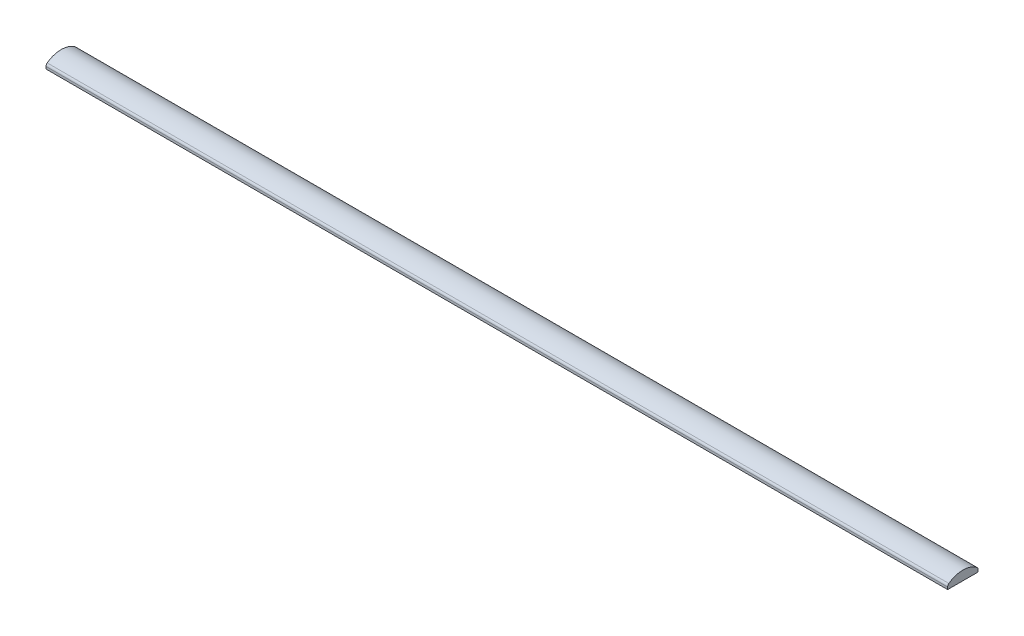
from build123d import *

# Parameters (mm, degrees)
BOSS_EXTRUDE1_DEPTH = 150


with BuildPart() as part:
    # Sketch1 → Boss-Extrude1 (new, symmetric)
    with BuildSketch(Plane(origin=(0, 0, 0), x_dir=(0, 0, -1), z_dir=(1, 0, 0))):
        with BuildLine():
            Line((-5.05, -0.625), (5.05, -0.625))
            Line((5.05, -0.625), (5.05, 0.141657769))
            ThreePointArc((5.05, 0.141657769), (4.942763552, 0.592183285), (4.644053518, 0.946083289))
            ThreePointArc((4.644053518, 0.946083289), (0, 2.475), (-4.644053518, 0.946083289))
            ThreePointArc((-4.644053518, 0.946083289), (-4.942763552, 0.592183285), (-5.05, 0.141657769))
            Line((-5.05, 0.141657769), (-5.05, -0.625))
        make_face()
    extrude(amount=BOSS_EXTRUDE1_DEPTH, both=True)


solid = part.part
